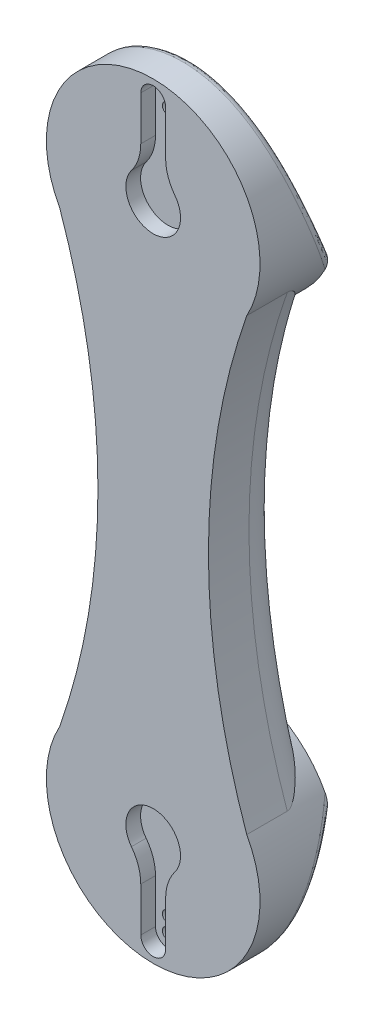
from build123d import *

# Parameters (mm, degrees)
BOSS_EXTRUDE1_DEPTH     = 21
CUT_EXTRUDE1_DEPTH      = 30
CUT_EXTRUDE1_DEPTH_BACK = 30
FILLET1_R               = 10
SKETCH4_R               = 5.75
CUT_EXTRUDE2_DEPTH      = 105
FILLET2_R               = 2
CUT_EXTRUDE3_START      = -6
SKETCH5_R               = 26
CUT_EXTRUDE3_DEPTH      = 125
SKETCH6_R               = 1.5000000000000042
SKETCH6_R_2             = 1.4999999999999991
SKETCH6_R_3             = 1.499999999999424
SKETCH6_R_4             = 1.4999999999999956
CUT_EXTRUDE4_DEPTH      = 50
SKETCH6_4_R             = 1.5000000000000042
SKETCH6_4_R_2           = 1.4999999999999991
SKETCH6_4_R_3           = 1.499999999999424
SKETCH6_4_R_4           = 1.4999999999999956
CUT_EXTRUDE5_DEPTH      = 4


with BuildPart() as part:
    # Sketch2 → Boss-Extrude1 (new body)
    with BuildSketch(Plane.XY):
        with BuildLine():
            ThreePointArc((-25.396850198400557, 135.99999999999991), (-15, 74.99999999999997), (-25.396850198400614, 14.000000000000007))
            ThreePointArc((-25.396850198400593, 13.999999999999996), (-1.599e-14, -28.999999999999996), (25.396850198400607, 13.999999999999964))
            ThreePointArc((25.39685019840067, 13.999999999999993), (15.000000000000114, 74.99999999999993), (25.396850198400585, 135.99999999999991))
            ThreePointArc((25.39685019840055, 135.99999999999994), (-1.323e-14, 179), (-25.396850198400557, 135.99999999999991))
        make_face()
    extrude(amount=BOSS_EXTRUDE1_DEPTH)

    # Sketch3 → Cut-Extrude1 (cut, two sides: drawn at the far end of the back side and taken through both)
    with BuildSketch(Plane(origin=(0, 0, 0), x_dir=(0, 0, -1), z_dir=(1, 0, 0)).offset(-CUT_EXTRUDE1_DEPTH_BACK)):
        with BuildLine():
            Line((-1.388e-14, 179), (-11.000000000000012, 179))
            ThreePointArc((-11.000000000000012, 179), (-8.194685173126771, 159.2199595551475), (-1.47e-15, 141))
            Line((-1.47e-15, 141), (-1.388e-14, 179))
        make_face()
        with BuildLine():
            Line((-1.388e-14, -29.00000000000097), (4.53e-15, 8.999999999999023))
            ThreePointArc((4.53e-15, 8.999999999999023), (-8.194685173126771, -9.219959555148463), (-11.000000000000012, -29.00000000000097))
            Line((-11.000000000000012, -29.00000000000097), (-1.388e-14, -29.00000000000097))
        make_face()
    extrude(amount=CUT_EXTRUDE1_DEPTH + CUT_EXTRUDE1_DEPTH_BACK, mode=Mode.SUBTRACT)

    # Fillet1
    # the kernel refuses this fillet: 10 mm, written as the material it takes off along each edge
    with BuildSketch(Plane(origin=(-199.14685318044874, 75.00000000000004, 0), x_dir=(0.890020065693421, 0.4559213557874634, 0), z_dir=(-0.4559213557874634, 0.890020065693421, 0))) as fillet1_piece_1_section:
        with BuildLine():
            CenterArc((184.14685318044874 + FILLET1_R, -FILLET1_R), FILLET1_R, 89.99999999999983, 90.00000000000017)
            Line((184.14685318044874 + FILLET1_R, 1.78e-15), (184.14685318044874, 0))
            Line((184.14685318044874, 0), (184.14685318044872, -FILLET1_R))
        make_face()
    fillet1_piece_1 = revolve(axis=Axis((-199.14685318044874, 75.00000000000004, 0), (0, 0, -1)), revolution_arc=54.2484631272309, mode=Mode.PRIVATE)
    fillet1_piece_1 = fillet1_piece_1 - Plane(origin=(-2.487e-14, 150, 2.7919601301796675), x_dir=(0.8757534551172608, -0.4827586206896569, 0), z_dir=(0, 0, -1)) * Cylinder(29, 777, mode=Mode.PRIVATE)
    fillet1_piece_1 = fillet1_piece_1 - Plane(origin=(8.9e-16, 5.77e-15, 2.7919601301796675), x_dir=(-0.8757534551172619, 0.4827586206896549, 0), z_dir=(0, 0, -1)) * Cylinder(29, 777, mode=Mode.PRIVATE)
    add(fillet1_piece_1, mode=Mode.SUBTRACT)
    with BuildSketch(Plane(origin=(199.14685318044968, 75.00000000000009, 0), x_dir=(-0.8900200656934213, -0.4559213557874625, 0), z_dir=(0.4559213557874625, -0.8900200656934213, 0))) as fillet1_piece_2_section:
        with BuildLine():
            CenterArc((184.14685318044954 + FILLET1_R, -FILLET1_R), FILLET1_R, 90, 90)
            Line((184.14685318044954 + FILLET1_R, 1.78e-15), (184.14685318044954, 0))
            Line((184.14685318044954, 0), (184.14685318044954, -FILLET1_R))
        make_face()
    fillet1_piece_2 = revolve(axis=Axis((199.14685318044968, 75.00000000000009, 0), (0, 0, -1)), revolution_arc=54.24846312723065, mode=Mode.PRIVATE)
    fillet1_piece_2 = fillet1_piece_2 - Plane(origin=(8.9e-16, 5.77e-15, 2.7919601301791364), x_dir=(-0.8757534551172619, 0.4827586206896549, 0), z_dir=(0, 0, -1)) * Cylinder(29, 777, mode=Mode.PRIVATE)
    fillet1_piece_2 = fillet1_piece_2 - Plane(origin=(-2.487e-14, 150, 2.7919601301791364), x_dir=(0.8757534551172608, -0.4827586206896569, 0), z_dir=(0, 0, -1)) * Cylinder(29, 777, mode=Mode.PRIVATE)
    add(fillet1_piece_2, mode=Mode.SUBTRACT)

    # Sketch4 → Cut-Extrude2 (cut)
    with BuildSketch(Plane(origin=(0, 0, 0), x_dir=(1, 0, 0), z_dir=(0, 1, 0))):
        with Locations(Location((0, -9, 0), (0, 0, 46.625925892))):
            Circle(SKETCH4_R)
    extrude(amount=CUT_EXTRUDE2_DEPTH, mode=Mode.SUBTRACT)

    # Fillet2
    fillet2_edges = [part.edges().sort_by_distance(p)[0] for p in [
        (-3.55e-15, 8.999999999999028, -2.27e-15),
        (-2.487e-14, 141, -2.82e-15),
        (24.02468752420244, 166.2423640323283, 9.846669705539417),
        (-1.288e-14, -29.000000000000483, 11.000000000000014),
    ]]
    fillet(fillet2_edges, radius=FILLET2_R)

    # Sketch5 → Cut-Extrude3 (cut)
    with BuildSketch(Plane.XY.offset(21).offset(CUT_EXTRUDE3_START)):
        with BuildLine():
            ThreePointArc((-22.769589833048855, 137.44827586206904), (-1.4946e-13, 124), (22.769589833048713, 137.4482758620688))
            ThreePointArc((22.76958983304871, 137.4482758620688), (25.1794493154563, 143.51961944247356), (25.99999999999999, 150))
            ThreePointArc((25.99999999999999, 150), (-6.480380557526325, 175.17944931545634), (-22.76958983304885, 137.44827586206904))
        make_face()
        Circle(SKETCH5_R)
    extrude(amount=-CUT_EXTRUDE3_DEPTH, mode=Mode.SUBTRACT)

    # Sketch6 → Cut-Extrude4 (cut)
    with BuildSketch(Plane(origin=(0, 0, 21), x_dir=(-1, 0, 0), z_dir=(0, 0, -1))):
        with Locations(Location((1.3e-16, 174.00000000000003, 0), (0, 0, 180))):
            Circle(SKETCH6_R)
        with Locations(Location((0, 170, 0), (0, 0, 180))):
            Circle(SKETCH6_R_2)
        with Locations(Location((0, -23.999999999999982, 0), (0, 0, 180))):
            Circle(SKETCH6_R_3)
        with Locations(Location((-6.1409e-13, -20.000000000000128, 0), (0, 0, 180))):
            Circle(SKETCH6_R_4)
    extrude(amount=CUT_EXTRUDE4_DEPTH, mode=Mode.SUBTRACT)

    # Sketch6<4> → Cut-Extrude5 (cut)
    # profile 1 of 2: a face of its own
    with BuildSketch(Plane(origin=(0, 0, 21), x_dir=(-1, 0, 0), z_dir=(0, 0, -1))):
        with BuildLine():
            Line((3.3750000000000133, 174.00000000000003), (3.3749999999999996, 162.02435029429864))
            ThreePointArc((3.3749999999999996, 162.02435029429864), (4.026280050241461, 158.0503463251046), (5.91198113207543, 154.49211577032284))
            ThreePointArc((5.91198113207543, 154.49211577032284), (-1.006e-14, 142.57500000000002), (-5.911981132075441, 154.4921157703229))
            ThreePointArc((-5.911981132075441, 154.4921157703229), (-4.026280050241418, 158.05034632510467), (-3.3750000000000133, 162.0243502942987))
            Line((-3.3750000000000133, 162.0243502942987), (-3.3750000000000133, 174.00000000000003))
            ThreePointArc((-3.3750000000000133, 174.00000000000003), (3.4e-16, 177.37500000000003), (3.3750000000000133, 174.00000000000003))
        make_face()
        with Locations(Location((1.3e-16, 174.00000000000003, 0), (0, 0, 180))):
            Circle(SKETCH6_4_R, mode=Mode.SUBTRACT)
        with Locations(Location((0, 170, 0), (0, 0, 180))):
            Circle(SKETCH6_4_R_2, mode=Mode.SUBTRACT)
    # profile 2 of 2: a face of its own
    with BuildSketch(Plane(origin=(0, 0, 21), x_dir=(-1, 0, 0), z_dir=(0, 0, -1))):
        with BuildLine():
            Line((-3.3750000000006484, -24.000000000000103), (-3.3750000000005427, -12.024350294298754))
            ThreePointArc((-3.3750000000005427, -12.024350294298754), (-4.026280050241976, -8.05034632510474), (-5.911981132075951, -4.492115770322991))
            ThreePointArc((-5.911981132075951, -4.492115770322991), (1.10181e-12, 7.425000000000181), (5.911981132074993, -4.492115770323074))
            ThreePointArc((5.911981132074993, -4.492115770323074), (4.026280050240949, -8.050346325104794), (3.374999999999453, -12.024350294298811))
            Line((3.374999999999453, -12.024350294298811), (3.374999999999347, -24.00000000000016))
            ThreePointArc((3.374999999999347, -24.00000000000016), (-2.827e-14, -27.37499999999933), (-3.3750000000006484, -24.000000000000103))
        make_face()
        with Locations(Location((0, -23.999999999999982, 0), (0, 0, 180))):
            Circle(SKETCH6_4_R_3, mode=Mode.SUBTRACT)
        with Locations(Location((-6.1409e-13, -20.000000000000128, 0), (0, 0, 180))):
            Circle(SKETCH6_4_R_4, mode=Mode.SUBTRACT)
    extrude(amount=CUT_EXTRUDE5_DEPTH, mode=Mode.SUBTRACT)


solid = part.part
